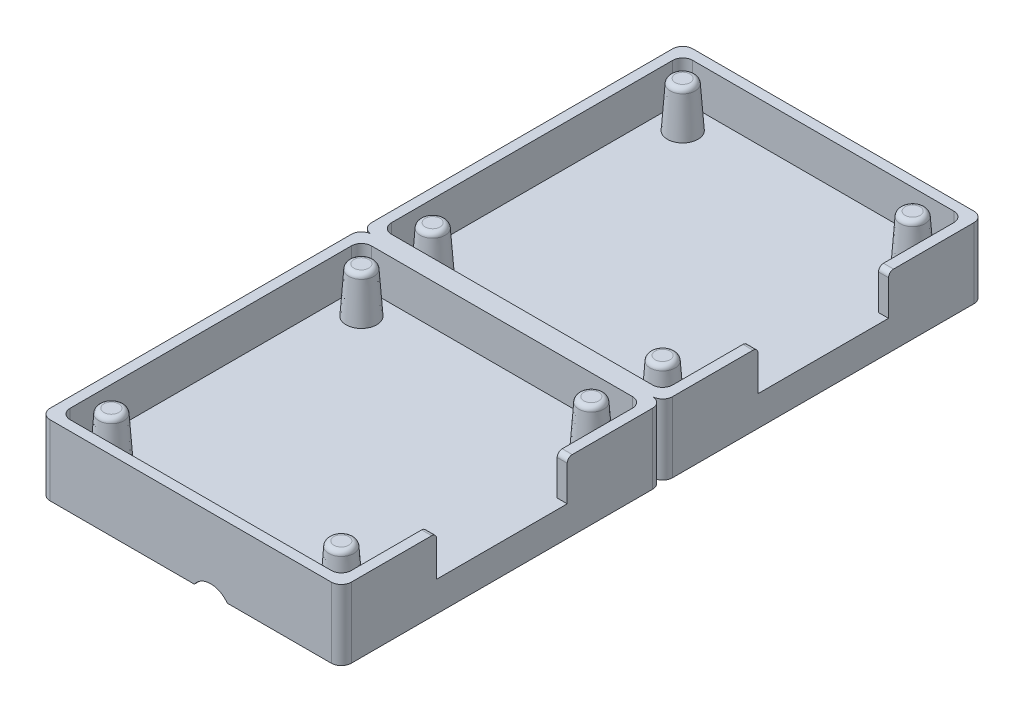
from build123d import *

# Parameters (mm, degrees)
BOSS_EXTRUDE1_DEPTH           = 28
SKETCH4_W                     = 28
SKETCH4_H                     = 3
BOSS_EXTRUDE2_DEPTH           = 30
INTERSECT1_DEPTH              = 28
BOSS_EXTRUDE3_DEPTH           = 1
BOSS_EXTRUDE3_DEPTH_BACK      = 10
EXTRUDE_THIN1_DEPTH           = 4
EXTRUDE_THIN1_DEPTH_BACK      = 3
SKETCH8_W                     = 30
SKETCH8_H                     = 32
SKETCH8_W_2                   = 28
SKETCH8_H_2                   = 30
FILLET1_R                     = 1
FILLET2_R                     = 0.5
SKETCH9_R                     = 1.525
BOSS_EXTRUDE4_DEPTH           = 4.5
BOSS_EXTRUDE4_DRAFT           = 4
BOSS_EXTRUDE4_PROFILE_2_DEPTH = 4.5
BOSS_EXTRUDE4_PROFILE_2_DRAFT = 4
BOSS_EXTRUDE4_PROFILE_3_DEPTH = 4.5
BOSS_EXTRUDE4_PROFILE_3_DRAFT = 4
BOSS_EXTRUDE4_PROFILE_4_DEPTH = 4.5
BOSS_EXTRUDE4_PROFILE_4_DRAFT = 4
CUT_EXTRUDE2_DEPTH            = 36.508062465
CUT_EXTRUDE2_DEPTH_BACK       = 36.508062465
SKETCH2_R                     = 2
SKETCH10_W                    = 13
SKETCH10_H                    = 4
CUT_EXTRUDE3_DEPTH            = 2
FILLET3_R                     = 0.5
FILLET4_R                     = 0.5
SCALE1_SCALE                  = 1.01


# Read off the part's stored shape, not the designer's step: Intersect1
with BuildPart() as part:
    # Sketch3 → Boss-Extrude1 (new body)
    with BuildSketch(Plane.XY):
        with BuildLine():
            Line((3.638185472, -1.147322256), (14, -0.95))
            Line((14, -0.95), (14, 1.15))
            Line((14, 1.15), (3.636306817, 1.15))
            ThreePointArc((3.636306817, 1.15), (2, 2), (0.363693183, 1.15))
            Line((0.363693183, 1.15), (-14, 1.15))
            Line((-14, 1.15), (-14, -0.95))
            Line((-14, -0.95), (0.240028409, -0.95))
            ThreePointArc((0.240028409, -0.95), (1.884060434, -1.996636676), (3.638185472, -1.147322256))
        make_face()
    extrude(amount=BOSS_EXTRUDE1_DEPTH)


with BuildPart() as body_2:
    # Sketch4 → Boss-Extrude2 (new body)
    with BuildSketch(Plane.XY):
        with Locations((0, 2.65)):
            Rectangle(SKETCH4_W, SKETCH4_H)
    extrude(amount=BOSS_EXTRUDE2_DEPTH)


with BuildPart() as intersect1_tool:
    # Intersect1 outline → Intersect1 (new body)
    with BuildSketch(Plane.XY):
        with BuildLine():
            Line((14, -0.95), (14, 1.15))
            Line((14, 1.15), (3.636306817, 1.15))
            ThreePointArc((3.636306817, 1.15), (2, 2), (0.363693183, 1.15))
            Line((0.363693183, 1.15), (-14, 1.15))
            Line((-14, 1.15), (-14, -0.95))
            Line((-14, -0.95), (0.240028409, -0.95))
            ThreePointArc((0.240028409, -0.95), (1.884060434, -1.996636676), (3.638185472, -1.147322256))
            Line((3.638185472, -1.147322256), (14, -0.95))
        make_face()
    extrude(amount=INTERSECT1_DEPTH)


with BuildPart() as part_1:
    add(part.part)

    # Intersect1: cut by intersect1_tool
    add(intersect1_tool.part, mode=Mode.SUBTRACT)


with BuildPart() as body_2_1:
    add(body_2.part)

    # Intersect1: cut by intersect1_tool
    add(intersect1_tool.part, mode=Mode.SUBTRACT)

    # Sketch6 → Boss-Extrude3 (add, two sides: drawn at the far end of the back side and taken through both)
    with BuildSketch(Plane.XY.offset(30).offset(-BOSS_EXTRUDE3_DEPTH_BACK)):
        Polygon((-10, 1.15), (-10, -0.95), (-13, -0.95), (-13, -3.95), (0, -3.95), (0, -0.95), (-3, -0.95), (-3, 1.15), align=None)
    extrude(amount=BOSS_EXTRUDE3_DEPTH + BOSS_EXTRUDE3_DEPTH_BACK)

    # Sketch8 → Extrude-Thin1 (add, two sides: drawn at the far end of the back side and taken through both)
    with BuildSketch(Plane(origin=(0, 4.15, 0), x_dir=(1, 0, 0), z_dir=(0, 1, 0)).offset(-EXTRUDE_THIN1_DEPTH_BACK)):
        with Locations((0, -15)):
            Rectangle(SKETCH8_W, SKETCH8_H)
        with Locations((0, -15)):
            Rectangle(SKETCH8_W_2, SKETCH8_H_2, mode=Mode.SUBTRACT)
    extrude(amount=EXTRUDE_THIN1_DEPTH + EXTRUDE_THIN1_DEPTH_BACK)

    # Fillet1
    fillet1_edges = [body_2_1.edges().sort_by_distance(p)[0] for p in [
        (14, 6.15, 0),
        (14, 6.15, 30),
        (-14, 6.15, 0),
        (-14, 6.15, 30),
        (15, 4.65, -1),
        (15, 4.65, 31),
        (-15, 4.65, 31),
        (-15, 4.65, -1),
    ]]
    fillet(fillet1_edges, radius=FILLET1_R)

    # Fillet2
    fillet2_edges = [body_2_1.edges().sort_by_distance(p)[0] for p in [
        (-11.5, -0.95, 20),
        (-1.5, -0.95, 20),
        (-11.5, -0.95, 31),
        (-1.5, -0.95, 31),
    ]]
    fillet(fillet2_edges, radius=FILLET2_R)


with BuildPart() as boss_extrude4_tool:
    # Sketch9 → Boss-Extrude4 (with draft: the straight prism first)
    with BuildSketch(Plane(origin=(0, 4.15, 0), x_dir=(1, 0, 0), z_dir=(0, 1, 0))):
        with Locations((11.45, -27.45)):
            Circle(SKETCH9_R)
    extrude(amount=BOSS_EXTRUDE4_DEPTH)
    # Boss-Extrude4: the draft: its side faces are tilted about the plane it starts from
    boss_extrude4_sides = [boss_extrude4_tool.faces().sort_by_distance(p)[0] for p in [
        (9.925, 6.4, 27.45),
    ]]
    draft(boss_extrude4_sides, Plane(origin=(0, 4.15, 0), x_dir=(1, 0, 0), z_dir=(0, 1, 0)), BOSS_EXTRUDE4_DRAFT)


with BuildPart() as body_2_2:
    add(body_2_1.part)

    # Boss-Extrude4: add boss_extrude4_tool
    add(boss_extrude4_tool.part)


with BuildPart() as boss_extrude4_profile_2_tool:
    # Sketch9 → Boss-Extrude4 profile 2 (with draft: the straight prism first)
    with BuildSketch(Plane(origin=(0, 4.15, 0), x_dir=(1, 0, 0), z_dir=(0, 1, 0))):
        with Locations((-11.45, -27.45)):
            Circle(SKETCH9_R)
    extrude(amount=BOSS_EXTRUDE4_PROFILE_2_DEPTH)
    # Boss-Extrude4 profile 2: the draft: its side faces are tilted about the plane it starts from
    boss_extrude4_profile_2_sides = [boss_extrude4_profile_2_tool.faces().sort_by_distance(p)[0] for p in [
        (-12.975, 6.4, 27.45),
    ]]
    draft(boss_extrude4_profile_2_sides, Plane(origin=(0, 4.15, 0), x_dir=(1, 0, 0), z_dir=(0, 1, 0)), BOSS_EXTRUDE4_PROFILE_2_DRAFT)


with BuildPart() as body_2_3:
    add(body_2_2.part)

    # Boss-Extrude4 profile 2: add boss_extrude4_profile_2_tool
    add(boss_extrude4_profile_2_tool.part)


with BuildPart() as boss_extrude4_profile_3_tool:
    # Sketch9 → Boss-Extrude4 profile 3 (with draft: the straight prism first)
    with BuildSketch(Plane(origin=(0, 4.15, 0), x_dir=(1, 0, 0), z_dir=(0, 1, 0))):
        with Locations((-11.45, -2.55)):
            Circle(SKETCH9_R)
    extrude(amount=BOSS_EXTRUDE4_PROFILE_3_DEPTH)
    # Boss-Extrude4 profile 3: the draft: its side faces are tilted about the plane it starts from
    boss_extrude4_profile_3_sides = [boss_extrude4_profile_3_tool.faces().sort_by_distance(p)[0] for p in [
        (-12.975, 6.4, 2.55),
    ]]
    draft(boss_extrude4_profile_3_sides, Plane(origin=(0, 4.15, 0), x_dir=(1, 0, 0), z_dir=(0, 1, 0)), BOSS_EXTRUDE4_PROFILE_3_DRAFT)


with BuildPart() as body_2_4:
    add(body_2_3.part)

    # Boss-Extrude4 profile 3: add boss_extrude4_profile_3_tool
    add(boss_extrude4_profile_3_tool.part)


with BuildPart() as boss_extrude4_profile_4_tool:
    # Sketch9 → Boss-Extrude4 profile 4 (with draft: the straight prism first)
    with BuildSketch(Plane(origin=(0, 4.15, 0), x_dir=(1, 0, 0), z_dir=(0, 1, 0))):
        with Locations((11.45, -2.55)):
            Circle(SKETCH9_R)
    extrude(amount=BOSS_EXTRUDE4_PROFILE_4_DEPTH)
    # Boss-Extrude4 profile 4: the draft: its side faces are tilted about the plane it starts from
    boss_extrude4_profile_4_sides = [boss_extrude4_profile_4_tool.faces().sort_by_distance(p)[0] for p in [
        (9.925, 6.4, 2.55),
    ]]
    draft(boss_extrude4_profile_4_sides, Plane(origin=(0, 4.15, 0), x_dir=(1, 0, 0), z_dir=(0, 1, 0)), BOSS_EXTRUDE4_PROFILE_4_DRAFT)


with BuildPart() as body_2_5:
    add(body_2_4.part)

    # Boss-Extrude4 profile 4: add boss_extrude4_profile_4_tool
    add(boss_extrude4_profile_4_tool.part)

    # Sketch2 → Cut-Extrude2 (cut, two sides: drawn at the far end of the back side and taken through both)
    with BuildSketch(Plane.XY.offset(-CUT_EXTRUDE2_DEPTH_BACK)):
        with Locations((2, 0)):
            Circle(SKETCH2_R)
    extrude(amount=CUT_EXTRUDE2_DEPTH + CUT_EXTRUDE2_DEPTH_BACK, mode=Mode.SUBTRACT)

    # Sketch10 → Cut-Extrude3 (cut)
    with BuildSketch(Plane(origin=(15, 0, 0), x_dir=(0, 0, -1), z_dir=(1, 0, 0))):
        with Locations((-15, 6.15)):
            Rectangle(SKETCH10_W, SKETCH10_H)
    extrude(amount=-CUT_EXTRUDE3_DEPTH, mode=Mode.SUBTRACT)

    # Fillet3
    fillet3_edges = [body_2_5.edges().sort_by_distance(p)[0] for p in [
        (10.239670654, 8.65, 27.45),
        (-12.660329346, 8.65, 27.45),
        (-12.660329346, 8.65, 2.55),
        (10.239670654, 8.65, 2.55),
        (14.5, 8.15, 21.5),
        (14.5, 8.15, 8.5),
    ]]
    fillet(fillet3_edges, radius=FILLET3_R)

    # Mirror5: body 2 across plane


with BuildPart() as body_2_6:
    add(body_2_5.part)
    add(body_2_5.part.mirror(Plane.XY.offset(31)))

    # Fillet4
    fillet4_edges = [body_2_6.edges().sort_by_distance(p)[0] for p in [
        (-10, -0.15, 20),
        (-3, -0.15, 20),
        (-3, -0.15, 42),
        (-10, -0.15, 42),
    ]]
    fillet(fillet4_edges, radius=FILLET4_R)


with BuildPart() as body_2_7:
    # Scale1: scaled about (-1.19720021, 2.483622693, 31)
    add(body_2_6.part.scale(SCALE1_SCALE).moved(Location((0.011972002, -0.024836227, -0.31))))


solid = body_2_7.part
